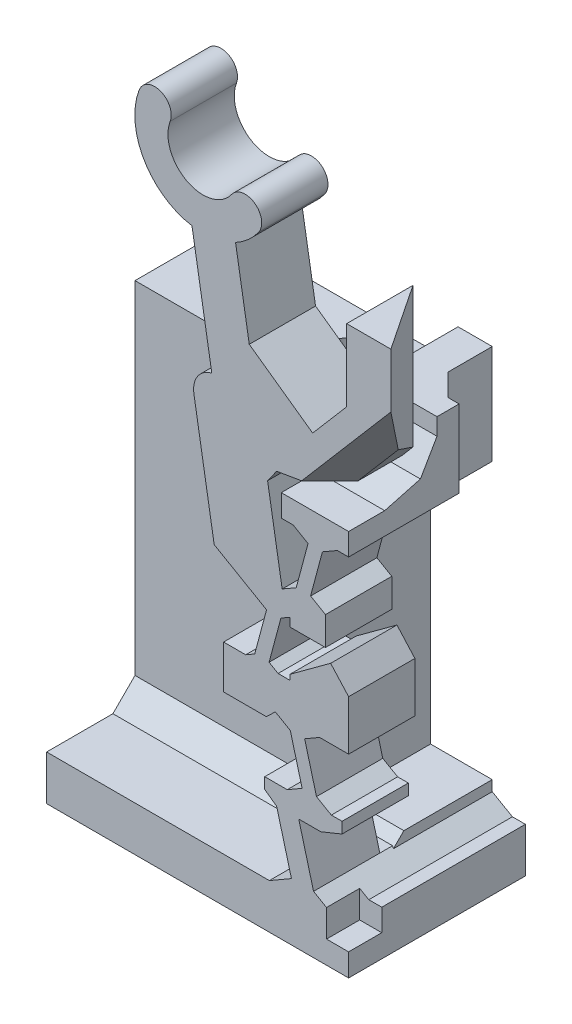
from build123d import *

# Parameters (mm, degrees)
BOSS_SWITCH_BODY_DEPTH                         = 3
SKETCH1_W                                      = 4
SKETCH1_H                                      = 3.5
BOSS_FLANGE_WIDTH_DEPTH                        = 5
BOSS_FLANGE_HEIGHT_REACH                       = 38.166
SKETCH2_W                                      = 4
SKETCH2_H                                      = 2
SKETCH2_W_2                                    = 8
SKETCH2_H_2                                    = 2.024975669
CUT_UP_TO_DOWN_DERAILLEUR_CLEARANCE_REACH      = 23.862
SKETCH10_W                                     = 2.453096586
SKETCH10_H                                     = 3
SKETCH17_W                                     = 12.1675
SKETCH17_H                                     = 4
BOSS_FLANGE_SUPPORT_DEPTH                      = 14.475024331
TAP_DRILL_FOR_M2X0_4_TAP1_D                    = 1.6
M2_CLEARANCE_HOLE2_D                           = 2.4
M2_CLEARANCE_HOLE2_DEPTH                       = 15
M2_CLEARANCE_HOLE2_TIP                         = 0.721032743
CUT_UP_TO_DOWN_CANTILEVER_SLOPE_REACH          = 31.347
CUT_DOWN_TO_UP_DERAILLEUR_CLEARANCE_DEPTH      = 33.69867621
CUT_DOWN_TO_UP_DERAILLEUR_CLEARANCE_DEPTH_BACK = 33.69867621
CHAMFER_FLANGE_SUPPORT_SIZE                    = 1.5
CHAMFER_FLANGE_SUPPORT_2_SIZE                  = 1
CHAMFER_FLANGE_SUPPORT_3_SIZE                  = 1
SKETCH18_W                                     = 1.5
SKETCH18_H                                     = 1.577328106
CUT_DOWN_TO_UP_DERAILLEUR_CLEARANCE_2_DEPTH    = 1
SKETCH19_W                                     = 3.046903414
SKETCH19_H                                     = 2.563581512
CUT_UP_TO_DOWN_CANTILEVER_CLEARANCE_DEPTH      = 1
CHAMFER1_SIZE                                  = 1
CHAMFER1_SIZE_2                                = 1.732050808
CHAMFER3_SIZE                                  = 0.75
CHAMFER3_SIZE_2                                = 1.299038106
CHAMFER4_SIZE                                  = 0.866025404
CHAMFER4_SIZE2                                 = 0.5
CHAMFER5_SIZE                                  = 0.5
CHAMFER6_SIZE                                  = 2.5
CHAMFER7_SIZE                                  = 1
CUT_EXTRUDE3_REACH                             = 33.008
CHAMFER8_SIZE                                  = 0.5
CHAMFER8_SIZE2                                 = 1.366025404
SKETCH23_W                                     = 2.791062273
SKETCH23_H                                     = 12.475024331
CUT_EXTRUDE4_DEPTH                             = 31.862053717


# Some blends are built 0.0001 mm under size
with BuildPart() as part:
    # Sketch-SwitchBossUp → Boss-Switch Body (new body)
    with BuildSketch(Plane.XY):
        with BuildLine():
            Line((6.540476927, 21.177422148), (6.540476927, 24.438379064))
            Line((6.540476927, 24.438379064), (8.540476927, 24.438379064))
            Line((8.540476927, 24.438379064), (8.540476927, 20.438379064))
            Line((8.540476927, 20.438379064), (6.040476927, 17.517528279))
            Line((6.040476927, 17.517528279), (2.878366495, 16.985217616))
            Line((2.878366495, 16.985217616), (3.620297651, 12.577888564))
            Line((3.620297651, 12.577888564), (4.256080915, 12.944958203))
            Line((4.256080915, 12.944958203), (4.791964496, 14.944962169))
            Line((4.791964496, 14.944962169), (4.116925685, 15.334689347))
            Line((4.116925685, 15.334689347), (3.581073513, 15.334689347))
            Line((3.581073513, 15.334689347), (3.581073513, 16.334689347))
            Line((3.581073513, 16.334689347), (6.857327822, 16.334689347))
            Line((6.857327822, 16.334689347), (13.441607507, 16.334689347))
            Line((13.441607507, 16.334689347), (13.441607507, -1.165310653))
            Line((13.441607507, -1.165310653), (5.040476927, -1.165310653))
            Line((5.040476927, -1.165310653), (3.040476927, -1.165310653))
            Line((3.040476927, -1.165310653), (3.040476927, 0.859665016))
            Line((3.040476927, 0.859665016), (4.040476927, 1.437015286))
            Line((4.040476927, 1.437015286), (3.370603946, 3.937015286))
            Line((3.370603946, 3.937015286), (2.83114552, 4.326718942))
            Line((2.83114552, 4.326718942), (2.83114552, 4.826718942))
            Line((2.83114552, 4.826718942), (3.58114552, 4.826718942))
            Line((3.58114552, 4.826718942), (3.849107629, 4.826718942))
            Line((3.849107629, 4.826718942), (4.524094713, 5.216429578))
            Line((4.524094713, 5.216429578), (3.988181525, 7.216425611))
            Line((3.988181525, 7.216425611), (3.311378308, 7.607171452))
            Line((3.311378308, 7.607171452), (2.9061262, 7.216422599))
            Line((2.9061262, 7.216422599), (0.971280482, 7.216422599))
            Line((0.971280482, 7.216422599), (0.971280482, 9.174382361))
            Line((0.971280482, 9.174382361), (1.971280482, 9.174382361))
            Line((1.971280482, 9.174382361), (2.378329551, 9.409396267))
            Line((2.378329551, 9.409396267), (2.914213132, 11.409400234))
            Line((2.914213132, 11.409400234), (0.544476723, 12.777544801))
            Line((0.544476723, 12.777544801), (-0.372784255, 18.226393961))
            ThreePointArc((-0.372784255, 18.226393961), (-0.209313172, 18.996084896), (0.435897335, 19.446473985))
            Line((0.435897335, 19.446473985), (-0.46073685, 24.772792819))
            ThreePointArc((-0.46073685, 24.772792819), (-2.630501593, 26.270619745), (-2.852546321, 28.897797067))
            ThreePointArc((-2.852546321, 28.897797067), (-1.887813913, 29.338582026), (-1.447028953, 28.373849618))
            ThreePointArc((-1.447028953, 28.373849618), (-0.703448682, 26.416936722), (1.333779254, 26.898727173))
            ThreePointArc((1.333779254, 26.898727173), (2.379722745, 27.074801628), (2.555797201, 26.028858137))
            ThreePointArc((2.555797201, 26.028858137), (2.086504637, 25.507104397), (1.511513111, 25.104801997))
            Line((1.511513111, 25.104801997), (2.546357317, 18.957467576))
            Line((2.546357317, 18.957467576), (4.992893704, 19.36931828))
            Line((4.992893704, 19.36931828), (6.540476927, 21.177422148))
        make_face()
        Polygon((5.581091201, 12.555245643), (5.581100766, 11.263016278), (3.971265023, 11.263016278), (3.97126394, 11.644419955), (3.564213132, 11.409405045), (3.028329551, 9.409401078), (3.435400868, 9.174382361), (3.971278743, 9.174382361), (3.971278743, 9.409408058), (5.815189335, 10.763016278), (6.627976927, 9.860324206), (6.627976927, 8.365258971), (6.627976927, 7.607171452), (5.314953271, 7.607171452), (4.638181525, 7.216430422), (5.174094713, 5.216434389), (5.845334952, 4.828900281), (6.33114552, 4.828900281), (6.33114552, 4.328900281), (5.370603946, 3.937015286), (4.370603946, 3.937015286), (5.040476927, 1.437015286), (6.040489723, 0.85968718), (9.127976927, 0.85968718), (10.437466736, 2.169176988), (10.437466736, 14.025199539), (9.127976927, 15.334689347), (6.116971898, 15.334689347), (5.441964496, 14.94496698), (4.906080915, 12.944963014), align=None, mode=Mode.SUBTRACT)
    extrude(amount=BOSS_SWITCH_BODY_DEPTH)

    # Sketch1 → Boss-Flange Width (add)
    with BuildSketch(Plane(origin=(0, 0, 0), x_dir=(-1, 0, 0), z_dir=(0, 0, -1))):
        Polygon((-7.581073513, -1.165310653), (0.412170615, -1.165310653), (0.412170615, 0.859665016), (-3.040476927, 0.859665016), (-4.040476927, 1.437015286), (-5.040476927, 1.437015286), (-6.040489723, 0.85968718), (-7.581073513, 0.85968718), align=None)
        with Locations((-5.581073513, 17.084689347)):
            Rectangle(SKETCH1_W, SKETCH1_H)
    extrude(amount=BOSS_FLANGE_WIDTH_DEPTH)

    # Sketch2 → Boss-Flange Height (add, up to next)
    with BuildSketch(Plane(origin=(-7.039523073, 0, 0), x_dir=(0, 0, -1), z_dir=(1, 0, 0)), mode=Mode.PRIVATE) as boss_flange_height_sk1:
        with Locations((3, 16.334689347)):
            Rectangle(SKETCH2_W, SKETCH2_H)
    boss_flange_height_tool1 = extrude(boss_flange_height_sk1.sketch, amount=BOSS_FLANGE_HEIGHT_REACH, mode=Mode.PRIVATE) - part.part
    # Sketch2 → Boss-Flange Height (add, up to next)
    with BuildSketch(Plane(origin=(-7.039523073, 0, 0), x_dir=(0, 0, -1), z_dir=(1, 0, 0)), mode=Mode.PRIVATE) as boss_flange_height_sk2:
        with Locations((1, -0.152822819)):
            Rectangle(SKETCH2_W_2, SKETCH2_H_2)
    boss_flange_height_tool2 = extrude(boss_flange_height_sk2.sketch, amount=BOSS_FLANGE_HEIGHT_REACH, mode=Mode.PRIVATE) - part.part
    add(boss_flange_height_tool1.solids().sort_by_distance((-7.039523, 16.334689, -3))[0])
    add(boss_flange_height_tool2.solids().sort_by_distance((-7.039523, -0.152823, -1))[0])

    # Sketch10 → Cut-Up-To-Down Derailleur Clearance (cut, up to next)
    with BuildSketch(Plane(origin=(0, 15.334689347, 0), x_dir=(1, 0, 0), z_dir=(0, 1, 0)), mode=Mode.PRIVATE) as cut_up_to_down_derailleur_clearance_sk1:
        with Locations((6.35452522, 3.5)):
            Rectangle(SKETCH10_W, SKETCH10_H)
    cut_up_to_down_derailleur_clearance_tool1 = extrude(cut_up_to_down_derailleur_clearance_sk1.sketch, amount=CUT_UP_TO_DOWN_DERAILLEUR_CLEARANCE_REACH, mode=Mode.PRIVATE) & part.part
    add(cut_up_to_down_derailleur_clearance_tool1.solids().sort_by_distance((6.354525, 15.334689, -3.5))[0], mode=Mode.SUBTRACT)

    # Sketch17 → Boss-Flange Support (add)
    with BuildSketch(Plane.XZ.offset(-15.334689347)):
        with Locations((-0.955773073, -3)):
            Rectangle(SKETCH17_W, SKETCH17_H)
    extrude(amount=BOSS_FLANGE_SUPPORT_DEPTH)

    # Tap Drill for M2x0.4 Tap1 (through all)
    with Locations(Plane(origin=(0, -1.165310653, 0), x_dir=(-1, 0, 0), z_dir=(0, -1, 0))):
        with Locations((4.039523073, 3), (-0.581073513, 3)):
            Hole(TAP_DRILL_FOR_M2X0_4_TAP1_D / 2)

    # M2 Clearance Hole2
    with Locations(Plane.XZ.offset(1.165310653)):
        with Locations((-4.039523073, -3), (0.581073513, -3)):
            Hole(M2_CLEARANCE_HOLE2_D / 2, depth=M2_CLEARANCE_HOLE2_DEPTH)
            with Locations((0, 0, -(M2_CLEARANCE_HOLE2_DEPTH + M2_CLEARANCE_HOLE2_TIP / 2))):  # 118° drill point
                Cone(0, M2_CLEARANCE_HOLE2_D / 2, M2_CLEARANCE_HOLE2_TIP, mode=Mode.SUBTRACT)

    # Sketch12 → Cut-Up-to-Down Cantilever Slope (cut, up to next)
    with BuildSketch(Plane(origin=(0, 24.438379064, 0), x_dir=(1, 0, 0), z_dir=(0, 1, 0)), mode=Mode.PRIVATE) as cut_up_to_down_cantilever_slope_sk1:
        Polygon((6.540476927, 0), (8.540476927, -3), (8.540476927, 0), align=None)
    cut_up_to_down_cantilever_slope_tool1 = extrude(cut_up_to_down_cantilever_slope_sk1.sketch, amount=-CUT_UP_TO_DOWN_CANTILEVER_SLOPE_REACH, mode=Mode.PRIVATE) & part.part
    add(cut_up_to_down_cantilever_slope_tool1.solids().sort_by_distance((7.87381, 24.438379, 1))[0], mode=Mode.SUBTRACT)

    # Sketch16 → Cut-Down-to-Up Derailleur Clearance (cut, two sides: drawn at the far end of the back side and taken through both)
    with BuildSketch(Plane(origin=(0, 0, 0), x_dir=(-1, 0, 0), z_dir=(0, 0, -1)).offset(-CUT_DOWN_TO_UP_DERAILLEUR_CLEARANCE_DEPTH_BACK)):
        Polygon((-7.581073513, 18.834689347), (-13.441607507, 18.834689347), (-13.441607507, -1.165310653), (-6.627976927, -1.165310653), (-6.627976927, 5.203794929), (-8.003689255, 5.203794929), (-8.003689255, 12.048417413), (-6.627976927, 12.048417413), (-6.627976927, 17.947659965), align=None)
    extrude(amount=CUT_DOWN_TO_UP_DERAILLEUR_CLEARANCE_DEPTH + CUT_DOWN_TO_UP_DERAILLEUR_CLEARANCE_DEPTH_BACK, mode=Mode.SUBTRACT)

    # Chamfer-Flange Support
    chamfer_flange_support_edges = [part.edges().sort_by_distance(p)[0] for p in [
        (3.581073513, 17.334689347, -3),
    ]]
    chamfer(chamfer_flange_support_edges, length=CHAMFER_FLANGE_SUPPORT_SIZE - 0.0001)  # a hair under: the kernel refuses the full size

    # Chamfer-Flange Support 2
    chamfer_flange_support_2_edges = [part.edges().sort_by_distance(p)[0] for p in [
        (5.127976927, 17.084689347, -2),
        (5.127976927, 15.334689347, -1.5),
    ]]
    chamfer(chamfer_flange_support_2_edges, length=CHAMFER_FLANGE_SUPPORT_2_SIZE)

    # Chamfer-Flange Support 3
    chamfer_flange_support_3_edges = [part.edges().sort_by_distance(p)[0] for p in [
        (-1.999523073, 0.859665016, -1),
    ]]
    chamfer(chamfer_flange_support_3_edges, length=CHAMFER_FLANGE_SUPPORT_3_SIZE)

    # Sketch18 → Cut-Down-to-Up Derailleur Clearance 2 (cut)
    with BuildSketch(Plane(origin=(6.627976927, 0, 0), x_dir=(0, 0, -1), z_dir=(1, 0, 0))):
        with Locations((-2.25, 0.648351233)):
            Rectangle(SKETCH18_W, SKETCH18_H)
    extrude(amount=-CUT_DOWN_TO_UP_DERAILLEUR_CLEARANCE_2_DEPTH, mode=Mode.SUBTRACT)

    # Sketch19 → Cut-Up-to-Down Cantilever Clearance (cut)
    with BuildSketch(Plane.XY):
        with Locations((5.10452522, 17.616480103)):
            Rectangle(SKETCH19_W, SKETCH19_H)
    extrude(amount=-CUT_UP_TO_DOWN_CANTILEVER_CLEARANCE_DEPTH, mode=Mode.SUBTRACT)

    # Chamfer1
    # the kernel refuses this chamfer: 1.732050808, 1 mm, written as the material it adds along each edge
    with BuildSketch(Plane(origin=(6.627976927, 16.334689347, -1), x_dir=(0, -0.05789386240266977, 0.9983227437537926), z_dir=(-1, 0, 0))) as chamfer1_piece_1:
        Polygon((CHAMFER1_SIZE * 0.998322743754, CHAMFER1_SIZE * 0.0578938624027), (-CHAMFER1_SIZE_2 * 0.0578938623883, CHAMFER1_SIZE_2 * 0.998322743505), (0, 0), align=None)
    extrude(amount=3.046903414)

    # Chamfer3
    # the kernel refuses this chamfer: 1.299038106, 0.75 mm, written as the material it adds along each edge
    with BuildSketch(Plane(origin=(3.581073513, 15.334689347, -1), x_dir=(0.05789386240236086, -1.5934376059306423e-13, 0.9983227437538106), z_dir=(0, 1, 0))) as chamfer3_piece_1_section:
        Polygon((CHAMFER3_SIZE * 0.998322743754, -CHAMFER3_SIZE * 0.0578938624027), (-CHAMFER3_SIZE_2 * 0.057893862388, -CHAMFER3_SIZE_2 * 0.998322743505), (0, 0), align=None)
    chamfer3_piece_1 = extrude(amount=6.092773786, mode=Mode.PRIVATE)
    chamfer3_piece_1 = split(chamfer3_piece_1, bisect_by=Plane(origin=(3.127107762, 16.799062109, -0.268105739), z_dir=(0, -0.4999999999999566, -0.8660254037844637)), keep=Keep.TOP, mode=Mode.PRIVATE)
    chamfer3_piece_1 = split(chamfer3_piece_1, bisect_by=Plane(origin=(2.18713947, 17.440655304, -0.784906566), z_dir=(0.7071067811865476, -0.7071067811865476, 0)), keep=Keep.TOP, mode=Mode.PRIVATE)
    add(chamfer3_piece_1)

    # Chamfer4
    chamfer4_edges = [part.edges().sort_by_distance(p)[0] for p in [
        (4.205006167, 15.334689347, -1),
    ]]
    chamfer4_side = [part.faces().sort_by_distance(p)[0] for p in [
        (-1.082771879, 9.403372689, -1),
    ]]
    chamfer(chamfer4_edges, length=CHAMFER4_SIZE, length2=CHAMFER4_SIZE2, reference=chamfer4_side[0])

    # Chamfer5
    chamfer5_edges = [part.edges().sort_by_distance(p)[0] for p in [
        (2.878366495, 16.985217616, 1.5),
    ]]
    chamfer(chamfer5_edges, length=CHAMFER5_SIZE)

    # Chamfer6
    # the kernel refuses this chamfer: 2.5 mm, written as the material it adds along each edge
    with BuildSketch(Plane(origin=(2.546357317, 18.957467576, 0), x_dir=(0.9903165846799726, 0.13882745444541758, 0), z_dir=(0, 0, 1))) as chamfer6_piece_1:
        Polygon((CHAMFER6_SIZE * 0.999621916911, CHAMFER6_SIZE * 0.0274958766106), (-CHAMFER6_SIZE * 0.0274958766106, CHAMFER6_SIZE * 0.999621916911), (0, 0), align=None)
    extrude(amount=3)

    # Chamfer7
    chamfer7_edges = [part.edges().sort_by_distance(p)[0] for p in [
        (7.290476927, 18.977953671, 3),
    ]]
    chamfer(chamfer7_edges, length=CHAMFER7_SIZE)

    # Sketch22 → Cut-Extrude3 (cut, up to next)
    with BuildSketch(Plane.XY, mode=Mode.PRIVATE) as cut_extrude3_sk1:
        Polygon((6.627976927, 17.947659965), (7.581073513, 18.834689347), (6.627976927, 18.834689347), align=None)
    cut_extrude3_tool1 = extrude(cut_extrude3_sk1.sketch, amount=-CUT_EXTRUDE3_REACH, mode=Mode.PRIVATE) & part.part
    add(cut_extrude3_tool1.solids().sort_by_distance((6.945676, 18.539013, 0))[0], mode=Mode.SUBTRACT)

    # Chamfer8
    chamfer8_edges = [part.edges().sort_by_distance(p)[0] for p in [
        (5.10452522, 16.334689347, 0),
    ]]
    chamfer8_side = [part.faces().sort_by_distance(p)[0] for p in [
        (4.861507649, 17.252033573, -0.529628936),
    ]]
    chamfer(chamfer8_edges, length=CHAMFER8_SIZE, length2=CHAMFER8_SIZE2, reference=chamfer8_side[0])

    # Sketch23 → Cut-Extrude4 (cut, through all)
    with BuildSketch(Plane.XY.offset(-1)):
        with Locations((3.732445791, 8.097177182)):
            Rectangle(SKETCH23_W, SKETCH23_H)
    extrude(amount=-CUT_EXTRUDE4_DEPTH, mode=Mode.SUBTRACT)


solid = part.part
